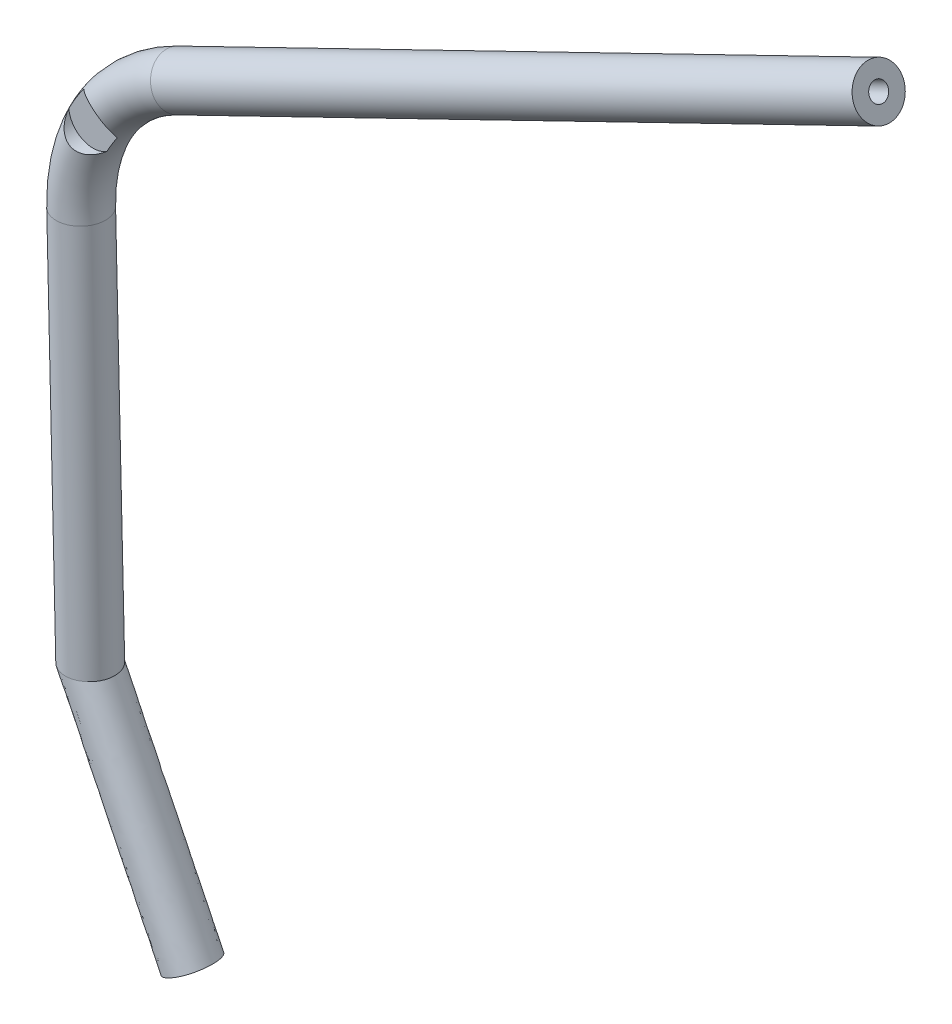
from build123d import *

# Parameters (mm, degrees)
SKETCH5_R               = 12.7
SKETCH5_R_2             = 4.7625
SKETCH6_R               = 12.7
SKETCH6_R_2             = 4.7625
BOSS_EXTRUDE3_DEPTH     = 406.4
SKETCH7_R               = 12.7
SKETCH7_R_2             = 4.7625
BOSS_EXTRUDE4_DEPTH     = 203.2
SKETCH8_R               = 12.7
CUT_EXTRUDE1_DEPTH      = 6.35
SKETCH9_R               = 12.7
SKETCH9_R_2             = 4.7625
CUT_EXTRUDE2_DEPTH      = 462.222817168
CUT_EXTRUDE2_DEPTH_BACK = 462.222817168


with BuildPart() as part:
    # Sweep1: sweep along a path in Sketch4
    with BuildLine(Plane.XY) as sweep1_path:
        ThreePointArc((-38.874671546, 79.949796199), (-75.907697444, 46.273442371), (-88.87582946, -2.072905643))
    # Sketch5 → Sweep1 (sweep)
    with BuildSketch(Plane(origin=(0, 0, 0), x_dir=(1, 0, 0), z_dir=(0, 1, 0))):
        with Locations((-88.87582946, 0)):
            Circle(SKETCH5_R)
        with Locations((-88.87582946, 0)):
            Circle(SKETCH5_R_2, mode=Mode.SUBTRACT)
    sweep(path=sweep1_path.line)

    # Sketch6 → Boss-Extrude3 (add)
    with BuildSketch(Plane(origin=(0, 0, 0), x_dir=(0, 0, -1), z_dir=(0.8993227918843839, 0.43728539421901275, 0))):
        with Locations((0, 88.87582946)):
            Circle(SKETCH6_R)
        with Locations((0, 88.87582946)):
            Circle(SKETCH6_R_2, mode=Mode.SUBTRACT)
    extrude(amount=BOSS_EXTRUDE3_DEPTH)

    # Sketch7 → Boss-Extrude4 (add)
    with BuildSketch(Plane(origin=(0, 0, 0), x_dir=(-0.9997281154099812, -0.023317273828803834, 0), z_dir=(0.023317273828803834, -0.9997281154099812, 0))):
        with Locations((88.87582946, 0)):
            Circle(SKETCH7_R)
        with Locations((88.87582946, 0)):
            Circle(SKETCH7_R_2, mode=Mode.SUBTRACT)
    extrude(amount=BOSS_EXTRUDE4_DEPTH)

    # Sketch8 → Cut-Extrude1 (cut)
    with BuildSketch(Plane.XY.offset(12.7)):
        with Locations((-76.269889492, 46.494235168)):
            Circle(SKETCH8_R)
    extrude(amount=-CUT_EXTRUDE1_DEPTH, mode=Mode.SUBTRACT)

    # Sweep2: sweep along a path in Sketch11
    with BuildLine(Plane.XY) as sweep2_path:
        Line((-84.113595449, -205.217095104), (-28.578350384, -319.431089673))
    # Sketch9 → Sweep2 (sweep)
    with BuildSketch(Plane(origin=(4.738070042, -203.144753051, 0), x_dir=(-0.9997281154099812, -0.023317273828803834, 0), z_dir=(0.023317273828803834, -0.9997281154099812, 0))):
        with Locations((88.87582946, 0)):
            Circle(SKETCH9_R)
        with Locations((88.87582946, 0)):
            Circle(SKETCH9_R_2, mode=Mode.SUBTRACT)
    sweep(path=sweep2_path.line)

    # Sketch16 → Cut-Extrude2 (cut, two sides: drawn at the far end of the back side and taken through both)
    with BuildSketch(Plane.XY.offset(-CUT_EXTRUDE2_DEPTH_BACK)):
        Polygon((-41.274897449, -319.727219051), (-20.504520989, -309.627861689), (-15.881803318, -319.134960295), align=None)
    extrude(amount=CUT_EXTRUDE2_DEPTH + CUT_EXTRUDE2_DEPTH_BACK, mode=Mode.SUBTRACT)


solid = part.part
